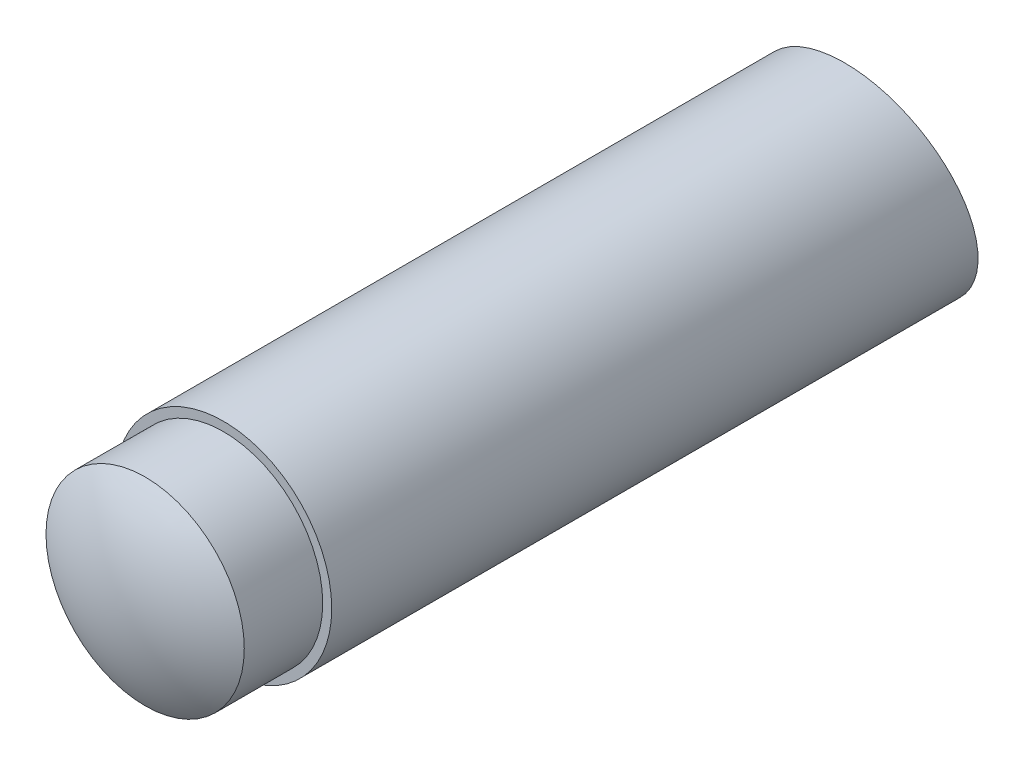
from build123d import *

# Parameters (mm, degrees)
SKETCH_1_R               = 6
EXTRUDE_1_DEPTH          = 43
SKETCH_2_OUTSIDE_W       = 23.246
SKETCH_2_OUTSIDE_H       = 23.246
SKETCH_2_OUTSIDE_R       = 5.5
CUT_EXTRUDE_1_DEPTH      = 6
CUT_EXTRUDE_2_DEPTH      = 44.829214002
CUT_EXTRUDE_2_DEPTH_BACK = 44.829214002
CUT_EXTRUDE_START        = -3.5
CUT_EXTRUDE_3_DEPTH      = 41.329214002


# Read off the part's stored shape, not the designer's step: 替换面1
with BuildPart() as part:
    # 草图1 → 凸台-拉伸1 (new body)
    with BuildSketch(Plane.XY):
        Circle(SKETCH_1_R)
    extrude(amount=EXTRUDE_1_DEPTH)

    # 草图2 outside → 切除-拉伸1 (cut)
    with BuildSketch(Plane.XY.offset(43)):
        Rectangle(SKETCH_2_OUTSIDE_W, SKETCH_2_OUTSIDE_H)
        Circle(SKETCH_2_OUTSIDE_R, mode=Mode.SUBTRACT)
    extrude(amount=-CUT_EXTRUDE_1_DEPTH, mode=Mode.SUBTRACT)

    # 替换面1 outline → 替换面1 (revolve, cut)
    with BuildSketch(Plane.XZ):
        with BuildLine():
            ThreePointArc((0, 43), (2.870847837, 42.579051764), (5.500000008, 41.351646539))
            Line((5.500000008, 41.351646539), (5.500000008, 43))
            Line((5.500000008, 43), (0, 43))
        make_face()
    revolve(axis=Axis((0, 0, 0), (0, 0, 1)), mode=Mode.SUBTRACT)

    # 草图5 → 切除-拉伸2 (cut, two sides: drawn at the far end of the back side and taken through both)
    with BuildSketch(Plane(origin=(0, 0, 0), x_dir=(0, 0, -1), z_dir=(1, 0, 0)).offset(-CUT_EXTRUDE_2_DEPTH_BACK)):
        Polygon((20.642732015, -103.11641858), (0, -6), (-2.55067874, 6), (-23.193410755, 103.11641858), (171.039426405, 144.40188261), (214.875569175, -61.83095455), align=None)
    extrude(amount=CUT_EXTRUDE_2_DEPTH + CUT_EXTRUDE_2_DEPTH_BACK, mode=Mode.SUBTRACT)

    # 草图6 → 切除-拉伸3 (cut, through all)
    with BuildSketch(Plane(origin=(0, 0, 0), x_dir=(0, 0, -1), z_dir=(1, 0, 0)).offset(CUT_EXTRUDE_START)):
        with BuildLine():
            Line((-15, -2.5), (-23, -2.5))
            ThreePointArc((-23, -2.5), (-25.5, 0), (-23, 2.5))
            Line((-23, 2.5), (-15, 2.5))
            ThreePointArc((-15, 2.5), (-12.5, 0), (-15, -2.5))
        make_face()
    extrude(amount=-CUT_EXTRUDE_3_DEPTH, mode=Mode.SUBTRACT)


solid = part.part
